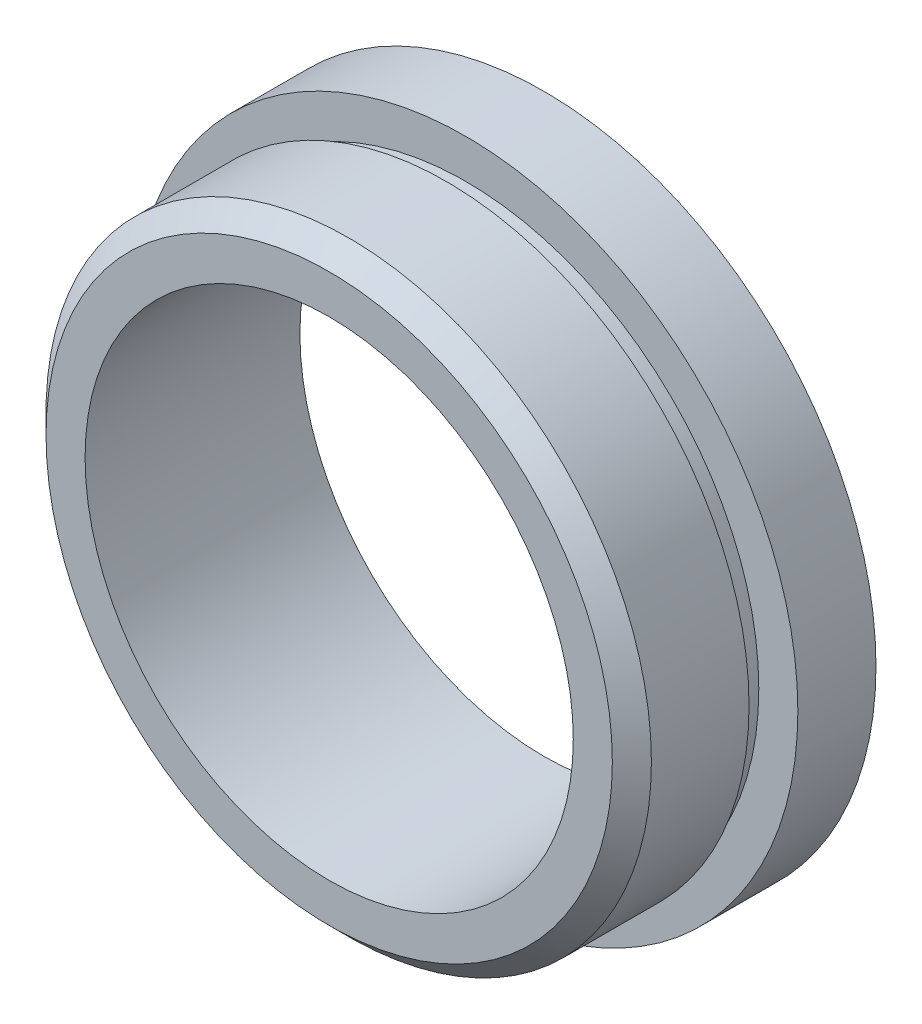
from build123d import *

# Parameters (mm, degrees)
SKETCH1_R           = 17
SKETCH1_R_2         = 12.5
BOSS_EXTRUDE1_DEPTH = 4
SKETCH2_R           = 15
SKETCH2_R_2         = 12.5
BOSS_EXTRUDE2_DEPTH = 1
SKETCH3_R           = 15.5
SKETCH3_R_2         = 12.5
BOSS_EXTRUDE3_DEPTH = 6
CHAMFER1_SIZE       = 1


with BuildPart() as part:
    # Sketch1 → Boss-Extrude1 (new body)
    with BuildSketch(Plane.XY):
        Circle(SKETCH1_R)
        Circle(SKETCH1_R_2, mode=Mode.SUBTRACT)
    extrude(amount=BOSS_EXTRUDE1_DEPTH)

    # Sketch2 → Boss-Extrude2 (add)
    with BuildSketch(Plane.XY.offset(4)):
        Circle(SKETCH2_R)
        Circle(SKETCH2_R_2, mode=Mode.SUBTRACT)
    extrude(amount=BOSS_EXTRUDE2_DEPTH)

    # Sketch3 → Boss-Extrude3 (add)
    with BuildSketch(Plane.XY.offset(5)):
        Circle(SKETCH3_R)
        Circle(SKETCH3_R_2, mode=Mode.SUBTRACT)
    extrude(amount=BOSS_EXTRUDE3_DEPTH)

    # Chamfer1
    chamfer1_edges = [part.edges().sort_by_distance(p)[0] for p in [
        (-15.5, 0, 11),
    ]]
    chamfer(chamfer1_edges, length=CHAMFER1_SIZE)

    # Sketch6 → Cut-Revolve4 (revolve, cut)
    with BuildSketch(Plane(origin=(0, 0, 0), x_dir=(0, 0, -1), z_dir=(1, 0, 0))):
        with BuildLine():
            Line((0, 14.5), (0, 15.6))
            Line((0, 15.6), (-1.560883383, 14.671907178))
            ThreePointArc((-1.560883383, 14.671907178), (-1.632511647, 14.598886259), (-1.658668305, 14.5))
            Line((-1.658668305, 14.5), (0, 14.5))
        make_face()
    revolve(axis=Axis((0, 14.5, 1.658668305), (0, 0, -1)), mode=Mode.SUBTRACT)


solid = part.part
